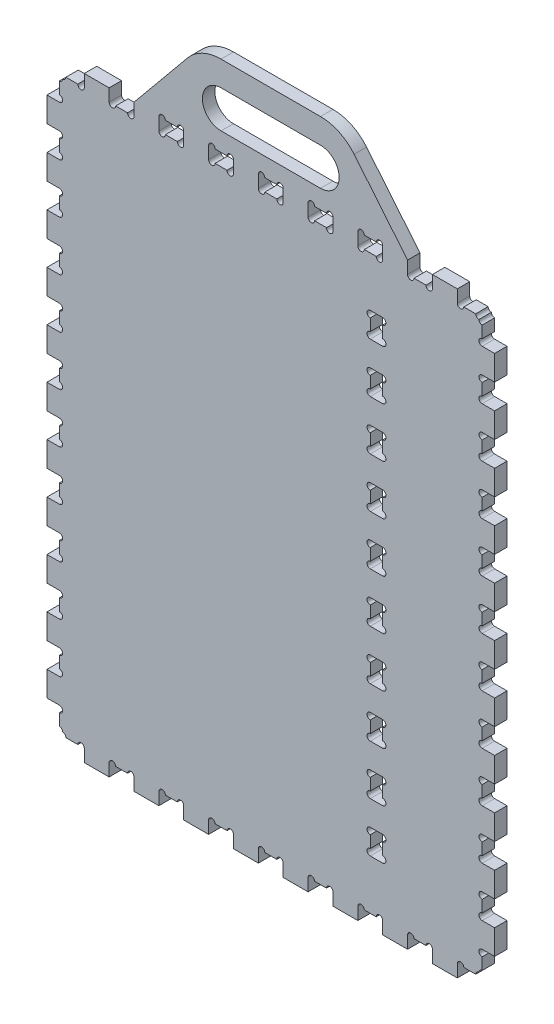
from build123d import *

# Parameters (mm, degrees)
SKETCH1_W               = 457.2
SKETCH1_H               = 609.6
BOSS_EXTRUDE1_DEPTH     = 12.7
CUT_EXTRUDE1_DEPTH      = 382.211607903
LPATTERN1_COUNT         = 9
LPATTERN1_PITCH         = 50.8
SKETCH6_W               = 12.7
SKETCH6_H               = 12.7
CUT_EXTRUDE4_DEPTH      = 382.211607903
CUT_EXTRUDE2_DEPTH      = 382.211607903
LPATTERN2_COUNT         = 12
LPATTERN2_PITCH         = 50.8
MIRROR7_COPY_1_SKETCH_W = 12.7
MIRROR7_COPY_1_SKETCH_H = 12.7
MIRROR7_COPY_1_DEPTH    = 382.211607903
MIRROR1_COPY_1_DEPTH    = 382.211607903
MIRROR1_COPY_2_DEPTH    = 382.211607903
MIRROR1_COPY_3_DEPTH    = 382.211607903
MIRROR1_COPY_4_DEPTH    = 382.211607903
MIRROR1_COPY_5_DEPTH    = 382.211607903
MIRROR1_COPY_6_DEPTH    = 382.211607903
MIRROR1_COPY_7_DEPTH    = 382.211607903
MIRROR1_COPY_8_DEPTH    = 382.211607903
MIRROR1_COPY_9_DEPTH    = 382.211607903
MIRROR1_COPY_10_DEPTH   = 382.211607903
MIRROR1_COPY_11_DEPTH   = 382.211607903
MIRROR1_COPY_12_DEPTH   = 382.211607903
MIRROR2_COPY_1_DEPTH    = 382.211607903
MIRROR2_COPY_2_DEPTH    = 382.211607903
MIRROR2_COPY_3_DEPTH    = 382.211607903
MIRROR2_COPY_4_DEPTH    = 382.211607903
MIRROR2_COPY_5_DEPTH    = 382.211607903
MIRROR2_COPY_6_DEPTH    = 382.211607903
MIRROR2_COPY_7_DEPTH    = 382.211607903
MIRROR2_COPY_8_DEPTH    = 382.211607903
MIRROR2_COPY_9_DEPTH    = 382.211607903
BOSS_EXTRUDE3_DEPTH     = 12.7
SKETCH10_R              = 3.302
CUT_EXTRUDE6_DEPTH      = 12.7
LPATTERN3_COUNT         = 5
LPATTERN3_PITCH         = 50.8
CUT_EXTRUDE7_DEPTH      = 450.954744947
LPATTERN4_COUNT         = 10
LPATTERN4_PITCH         = 50.8


with BuildPart() as part:
    # Sketch1 → Boss-Extrude1 (new body)
    with BuildSketch(Plane.XY):
        Rectangle(SKETCH1_W, SKETCH1_H)
    extrude(amount=BOSS_EXTRUDE1_DEPTH)

    # Sketch2 → Cut-Extrude1 (cut, through all)
    with BuildSketch(Plane.XY.offset(12.7)):
        with BuildLine():
            Line((-190.5, 304.8), (-215.9, 304.8))
            Line((-215.9, 304.8), (-215.9, 292.1))
            ThreePointArc((-215.9, 292.1), (-212.598, 288.798), (-209.296, 292.1))
            Line((-209.296, 292.1), (-197.104, 292.1))
            ThreePointArc((-197.104, 292.1), (-193.802, 288.798), (-190.5, 292.1))
            Line((-190.5, 292.1), (-190.5, 304.8))
        make_face()
    cut_extrude1 = extrude(amount=-CUT_EXTRUDE1_DEPTH, mode=Mode.SUBTRACT)

    # LPattern1: Cut-Extrude1 ×9
    with Locations(*[(i * LPATTERN1_PITCH, 0, 0) for i in range(1, LPATTERN1_COUNT)]):
        add(cut_extrude1, mode=Mode.SUBTRACT)

    # Sketch6 → Cut-Extrude4 (cut, through all)
    with BuildSketch(Plane.XY.offset(12.7)):
        with Locations((-222.25, 298.45)):
            Rectangle(SKETCH6_W, SKETCH6_H)
    cut_extrude4 = extrude(amount=-CUT_EXTRUDE4_DEPTH, mode=Mode.SUBTRACT)

    # Sketch3 → Cut-Extrude2 (cut, through all)
    with BuildSketch(Plane.XY.offset(12.7)):
        with BuildLine():
            Line((-215.9, 292.1), (-228.6, 292.1))
            Line((-228.6, 292.1), (-228.6, 266.7))
            Line((-228.6, 266.7), (-215.9, 266.7))
            ThreePointArc((-215.9, 266.7), (-212.598, 270.002), (-215.9, 273.304))
            Line((-215.9, 273.304), (-215.9, 285.496))
            ThreePointArc((-215.9, 285.496), (-212.598, 288.798), (-215.9, 292.1))
        make_face()
    cut_extrude2 = extrude(amount=-CUT_EXTRUDE2_DEPTH, mode=Mode.SUBTRACT)

    # LPattern2: Cut-Extrude2 ×12
    with Locations(*[(0, -i * LPATTERN2_PITCH, 0) for i in range(1, LPATTERN2_COUNT)]):
        add(cut_extrude2, mode=Mode.SUBTRACT)

    # Mirror6: Cut-Extrude4 across plane
    add(cut_extrude4.mirror(Plane(origin=(0, 0, 0), x_dir=(0, 0, 1), z_dir=(1, 0, 0))), mode=Mode.SUBTRACT)

    # Mirror7: Cut-Extrude4 across plane
    add(cut_extrude4.mirror(Plane.ZX), mode=Mode.SUBTRACT)

    # Mirror7 copy 1 sketch → Mirror7 copy 1 (cut, through all)
    with BuildSketch(Plane(origin=(0, 0, 12.7), x_dir=(-1, 0, 0), z_dir=(0, 0, 1))):
        with Locations((-222.25, 298.45)):
            Rectangle(MIRROR7_COPY_1_SKETCH_W, MIRROR7_COPY_1_SKETCH_H)
    extrude(amount=-MIRROR7_COPY_1_DEPTH, mode=Mode.SUBTRACT)

    # Mirror1 copy 1 sketch → Mirror1 copy 1 (cut, through all)
    with BuildSketch(Plane(origin=(0, -50.8, 12.7), x_dir=(-1, 0, 0), z_dir=(0, 0, 1))):
        with BuildLine():
            Line((-215.9, -292.1), (-228.6, -292.1))
            Line((-228.6, -292.1), (-228.6, -266.7))
            Line((-228.6, -266.7), (-215.9, -266.7))
            ThreePointArc((-215.9, -266.7), (-212.598, -270.002), (-215.9, -273.304))
            Line((-215.9, -273.304), (-215.9, -285.496))
            ThreePointArc((-215.9, -285.496), (-212.598, -288.798), (-215.9, -292.1))
        make_face()
    extrude(amount=-MIRROR1_COPY_1_DEPTH, mode=Mode.SUBTRACT)

    # Mirror1 copy 2 sketch → Mirror1 copy 2 (cut, through all)
    with BuildSketch(Plane(origin=(0, -101.6, 12.7), x_dir=(-1, 0, 0), z_dir=(0, 0, 1))):
        with BuildLine():
            Line((-215.9, -292.1), (-228.6, -292.1))
            Line((-228.6, -292.1), (-228.6, -266.7))
            Line((-228.6, -266.7), (-215.9, -266.7))
            ThreePointArc((-215.9, -266.7), (-212.598, -270.002), (-215.9, -273.304))
            Line((-215.9, -273.304), (-215.9, -285.496))
            ThreePointArc((-215.9, -285.496), (-212.598, -288.798), (-215.9, -292.1))
        make_face()
    extrude(amount=-MIRROR1_COPY_2_DEPTH, mode=Mode.SUBTRACT)

    # Mirror1 copy 3 sketch → Mirror1 copy 3 (cut, through all)
    with BuildSketch(Plane(origin=(0, -152.4, 12.7), x_dir=(-1, 0, 0), z_dir=(0, 0, 1))):
        with BuildLine():
            Line((-215.9, -292.1), (-228.6, -292.1))
            Line((-228.6, -292.1), (-228.6, -266.7))
            Line((-228.6, -266.7), (-215.9, -266.7))
            ThreePointArc((-215.9, -266.7), (-212.598, -270.002), (-215.9, -273.304))
            Line((-215.9, -273.304), (-215.9, -285.496))
            ThreePointArc((-215.9, -285.496), (-212.598, -288.798), (-215.9, -292.1))
        make_face()
    extrude(amount=-MIRROR1_COPY_3_DEPTH, mode=Mode.SUBTRACT)

    # Mirror1 copy 4 sketch → Mirror1 copy 4 (cut, through all)
    with BuildSketch(Plane(origin=(0, -203.2, 12.7), x_dir=(-1, 0, 0), z_dir=(0, 0, 1))):
        with BuildLine():
            Line((-215.9, -292.1), (-228.6, -292.1))
            Line((-228.6, -292.1), (-228.6, -266.7))
            Line((-228.6, -266.7), (-215.9, -266.7))
            ThreePointArc((-215.9, -266.7), (-212.598, -270.002), (-215.9, -273.304))
            Line((-215.9, -273.304), (-215.9, -285.496))
            ThreePointArc((-215.9, -285.496), (-212.598, -288.798), (-215.9, -292.1))
        make_face()
    extrude(amount=-MIRROR1_COPY_4_DEPTH, mode=Mode.SUBTRACT)

    # Mirror1 copy 5 sketch → Mirror1 copy 5 (cut, through all)
    with BuildSketch(Plane(origin=(0, -254, 12.7), x_dir=(-1, 0, 0), z_dir=(0, 0, 1))):
        with BuildLine():
            Line((-215.9, -292.1), (-228.6, -292.1))
            Line((-228.6, -292.1), (-228.6, -266.7))
            Line((-228.6, -266.7), (-215.9, -266.7))
            ThreePointArc((-215.9, -266.7), (-212.598, -270.002), (-215.9, -273.304))
            Line((-215.9, -273.304), (-215.9, -285.496))
            ThreePointArc((-215.9, -285.496), (-212.598, -288.798), (-215.9, -292.1))
        make_face()
    extrude(amount=-MIRROR1_COPY_5_DEPTH, mode=Mode.SUBTRACT)

    # Mirror1 copy 6 sketch → Mirror1 copy 6 (cut, through all)
    with BuildSketch(Plane(origin=(0, -304.8, 12.7), x_dir=(-1, 0, 0), z_dir=(0, 0, 1))):
        with BuildLine():
            Line((-215.9, -292.1), (-228.6, -292.1))
            Line((-228.6, -292.1), (-228.6, -266.7))
            Line((-228.6, -266.7), (-215.9, -266.7))
            ThreePointArc((-215.9, -266.7), (-212.598, -270.002), (-215.9, -273.304))
            Line((-215.9, -273.304), (-215.9, -285.496))
            ThreePointArc((-215.9, -285.496), (-212.598, -288.798), (-215.9, -292.1))
        make_face()
    extrude(amount=-MIRROR1_COPY_6_DEPTH, mode=Mode.SUBTRACT)

    # Mirror1 copy 7 sketch → Mirror1 copy 7 (cut, through all)
    with BuildSketch(Plane(origin=(0, -355.6, 12.7), x_dir=(-1, 0, 0), z_dir=(0, 0, 1))):
        with BuildLine():
            Line((-215.9, -292.1), (-228.6, -292.1))
            Line((-228.6, -292.1), (-228.6, -266.7))
            Line((-228.6, -266.7), (-215.9, -266.7))
            ThreePointArc((-215.9, -266.7), (-212.598, -270.002), (-215.9, -273.304))
            Line((-215.9, -273.304), (-215.9, -285.496))
            ThreePointArc((-215.9, -285.496), (-212.598, -288.798), (-215.9, -292.1))
        make_face()
    extrude(amount=-MIRROR1_COPY_7_DEPTH, mode=Mode.SUBTRACT)

    # Mirror1 copy 8 sketch → Mirror1 copy 8 (cut, through all)
    with BuildSketch(Plane(origin=(0, -406.4, 12.7), x_dir=(-1, 0, 0), z_dir=(0, 0, 1))):
        with BuildLine():
            Line((-215.9, -292.1), (-228.6, -292.1))
            Line((-228.6, -292.1), (-228.6, -266.7))
            Line((-228.6, -266.7), (-215.9, -266.7))
            ThreePointArc((-215.9, -266.7), (-212.598, -270.002), (-215.9, -273.304))
            Line((-215.9, -273.304), (-215.9, -285.496))
            ThreePointArc((-215.9, -285.496), (-212.598, -288.798), (-215.9, -292.1))
        make_face()
    extrude(amount=-MIRROR1_COPY_8_DEPTH, mode=Mode.SUBTRACT)

    # Mirror1 copy 9 sketch → Mirror1 copy 9 (cut, through all)
    with BuildSketch(Plane(origin=(0, -457.2, 12.7), x_dir=(-1, 0, 0), z_dir=(0, 0, 1))):
        with BuildLine():
            Line((-215.9, -292.1), (-228.6, -292.1))
            Line((-228.6, -292.1), (-228.6, -266.7))
            Line((-228.6, -266.7), (-215.9, -266.7))
            ThreePointArc((-215.9, -266.7), (-212.598, -270.002), (-215.9, -273.304))
            Line((-215.9, -273.304), (-215.9, -285.496))
            ThreePointArc((-215.9, -285.496), (-212.598, -288.798), (-215.9, -292.1))
        make_face()
    extrude(amount=-MIRROR1_COPY_9_DEPTH, mode=Mode.SUBTRACT)

    # Mirror1 copy 10 sketch → Mirror1 copy 10 (cut, through all)
    with BuildSketch(Plane(origin=(0, -508, 12.7), x_dir=(-1, 0, 0), z_dir=(0, 0, 1))):
        with BuildLine():
            Line((-215.9, -292.1), (-228.6, -292.1))
            Line((-228.6, -292.1), (-228.6, -266.7))
            Line((-228.6, -266.7), (-215.9, -266.7))
            ThreePointArc((-215.9, -266.7), (-212.598, -270.002), (-215.9, -273.304))
            Line((-215.9, -273.304), (-215.9, -285.496))
            ThreePointArc((-215.9, -285.496), (-212.598, -288.798), (-215.9, -292.1))
        make_face()
    extrude(amount=-MIRROR1_COPY_10_DEPTH, mode=Mode.SUBTRACT)

    # Mirror1 copy 11 sketch → Mirror1 copy 11 (cut, through all)
    with BuildSketch(Plane(origin=(0, -558.8, 12.7), x_dir=(-1, 0, 0), z_dir=(0, 0, 1))):
        with BuildLine():
            Line((-215.9, -292.1), (-228.6, -292.1))
            Line((-228.6, -292.1), (-228.6, -266.7))
            Line((-228.6, -266.7), (-215.9, -266.7))
            ThreePointArc((-215.9, -266.7), (-212.598, -270.002), (-215.9, -273.304))
            Line((-215.9, -273.304), (-215.9, -285.496))
            ThreePointArc((-215.9, -285.496), (-212.598, -288.798), (-215.9, -292.1))
        make_face()
    extrude(amount=-MIRROR1_COPY_11_DEPTH, mode=Mode.SUBTRACT)

    # Mirror1 copy 12 sketch → Mirror1 copy 12 (cut, through all)
    with BuildSketch(Plane(origin=(0, 0, 12.7), x_dir=(-1, 0, 0), z_dir=(0, 0, 1))):
        with BuildLine():
            Line((-215.9, -292.1), (-228.6, -292.1))
            Line((-228.6, -292.1), (-228.6, -266.7))
            Line((-228.6, -266.7), (-215.9, -266.7))
            ThreePointArc((-215.9, -266.7), (-212.598, -270.002), (-215.9, -273.304))
            Line((-215.9, -273.304), (-215.9, -285.496))
            ThreePointArc((-215.9, -285.496), (-212.598, -288.798), (-215.9, -292.1))
        make_face()
    extrude(amount=-MIRROR1_COPY_12_DEPTH, mode=Mode.SUBTRACT)

    # Mirror2 copy 1 sketch → Mirror2 copy 1 (cut, through all)
    with BuildSketch(Plane(origin=(50.8, 0, 12.7), x_dir=(1, 0, 0), z_dir=(0, 0, 1))):
        with BuildLine():
            Line((-190.5, -304.8), (-215.9, -304.8))
            Line((-215.9, -304.8), (-215.9, -292.1))
            ThreePointArc((-215.9, -292.1), (-212.598, -288.798), (-209.296, -292.1))
            Line((-209.296, -292.1), (-197.104, -292.1))
            ThreePointArc((-197.104, -292.1), (-193.802, -288.798), (-190.5, -292.1))
            Line((-190.5, -292.1), (-190.5, -304.8))
        make_face()
    extrude(amount=-MIRROR2_COPY_1_DEPTH, mode=Mode.SUBTRACT)

    # Mirror2 copy 2 sketch → Mirror2 copy 2 (cut, through all)
    with BuildSketch(Plane(origin=(101.6, 0, 12.7), x_dir=(1, 0, 0), z_dir=(0, 0, 1))):
        with BuildLine():
            Line((-190.5, -304.8), (-215.9, -304.8))
            Line((-215.9, -304.8), (-215.9, -292.1))
            ThreePointArc((-215.9, -292.1), (-212.598, -288.798), (-209.296, -292.1))
            Line((-209.296, -292.1), (-197.104, -292.1))
            ThreePointArc((-197.104, -292.1), (-193.802, -288.798), (-190.5, -292.1))
            Line((-190.5, -292.1), (-190.5, -304.8))
        make_face()
    extrude(amount=-MIRROR2_COPY_2_DEPTH, mode=Mode.SUBTRACT)

    # Mirror2 copy 3 sketch → Mirror2 copy 3 (cut, through all)
    with BuildSketch(Plane(origin=(152.4, 0, 12.7), x_dir=(1, 0, 0), z_dir=(0, 0, 1))):
        with BuildLine():
            Line((-190.5, -304.8), (-215.9, -304.8))
            Line((-215.9, -304.8), (-215.9, -292.1))
            ThreePointArc((-215.9, -292.1), (-212.598, -288.798), (-209.296, -292.1))
            Line((-209.296, -292.1), (-197.104, -292.1))
            ThreePointArc((-197.104, -292.1), (-193.802, -288.798), (-190.5, -292.1))
            Line((-190.5, -292.1), (-190.5, -304.8))
        make_face()
    extrude(amount=-MIRROR2_COPY_3_DEPTH, mode=Mode.SUBTRACT)

    # Mirror2 copy 4 sketch → Mirror2 copy 4 (cut, through all)
    with BuildSketch(Plane(origin=(203.2, 0, 12.7), x_dir=(1, 0, 0), z_dir=(0, 0, 1))):
        with BuildLine():
            Line((-190.5, -304.8), (-215.9, -304.8))
            Line((-215.9, -304.8), (-215.9, -292.1))
            ThreePointArc((-215.9, -292.1), (-212.598, -288.798), (-209.296, -292.1))
            Line((-209.296, -292.1), (-197.104, -292.1))
            ThreePointArc((-197.104, -292.1), (-193.802, -288.798), (-190.5, -292.1))
            Line((-190.5, -292.1), (-190.5, -304.8))
        make_face()
    extrude(amount=-MIRROR2_COPY_4_DEPTH, mode=Mode.SUBTRACT)

    # Mirror2 copy 5 sketch → Mirror2 copy 5 (cut, through all)
    with BuildSketch(Plane(origin=(254, 0, 12.7), x_dir=(1, 0, 0), z_dir=(0, 0, 1))):
        with BuildLine():
            Line((-190.5, -304.8), (-215.9, -304.8))
            Line((-215.9, -304.8), (-215.9, -292.1))
            ThreePointArc((-215.9, -292.1), (-212.598, -288.798), (-209.296, -292.1))
            Line((-209.296, -292.1), (-197.104, -292.1))
            ThreePointArc((-197.104, -292.1), (-193.802, -288.798), (-190.5, -292.1))
            Line((-190.5, -292.1), (-190.5, -304.8))
        make_face()
    extrude(amount=-MIRROR2_COPY_5_DEPTH, mode=Mode.SUBTRACT)

    # Mirror2 copy 6 sketch → Mirror2 copy 6 (cut, through all)
    with BuildSketch(Plane(origin=(304.8, 0, 12.7), x_dir=(1, 0, 0), z_dir=(0, 0, 1))):
        with BuildLine():
            Line((-190.5, -304.8), (-215.9, -304.8))
            Line((-215.9, -304.8), (-215.9, -292.1))
            ThreePointArc((-215.9, -292.1), (-212.598, -288.798), (-209.296, -292.1))
            Line((-209.296, -292.1), (-197.104, -292.1))
            ThreePointArc((-197.104, -292.1), (-193.802, -288.798), (-190.5, -292.1))
            Line((-190.5, -292.1), (-190.5, -304.8))
        make_face()
    extrude(amount=-MIRROR2_COPY_6_DEPTH, mode=Mode.SUBTRACT)

    # Mirror2 copy 7 sketch → Mirror2 copy 7 (cut, through all)
    with BuildSketch(Plane(origin=(355.6, 0, 12.7), x_dir=(1, 0, 0), z_dir=(0, 0, 1))):
        with BuildLine():
            Line((-190.5, -304.8), (-215.9, -304.8))
            Line((-215.9, -304.8), (-215.9, -292.1))
            ThreePointArc((-215.9, -292.1), (-212.598, -288.798), (-209.296, -292.1))
            Line((-209.296, -292.1), (-197.104, -292.1))
            ThreePointArc((-197.104, -292.1), (-193.802, -288.798), (-190.5, -292.1))
            Line((-190.5, -292.1), (-190.5, -304.8))
        make_face()
    extrude(amount=-MIRROR2_COPY_7_DEPTH, mode=Mode.SUBTRACT)

    # Mirror2 copy 8 sketch → Mirror2 copy 8 (cut, through all)
    with BuildSketch(Plane(origin=(406.4, 0, 12.7), x_dir=(1, 0, 0), z_dir=(0, 0, 1))):
        with BuildLine():
            Line((-190.5, -304.8), (-215.9, -304.8))
            Line((-215.9, -304.8), (-215.9, -292.1))
            ThreePointArc((-215.9, -292.1), (-212.598, -288.798), (-209.296, -292.1))
            Line((-209.296, -292.1), (-197.104, -292.1))
            ThreePointArc((-197.104, -292.1), (-193.802, -288.798), (-190.5, -292.1))
            Line((-190.5, -292.1), (-190.5, -304.8))
        make_face()
    extrude(amount=-MIRROR2_COPY_8_DEPTH, mode=Mode.SUBTRACT)

    # Mirror2 copy 9 sketch → Mirror2 copy 9 (cut, through all)
    with BuildSketch(Plane.XY.offset(12.7)):
        with BuildLine():
            Line((-190.5, -304.8), (-215.9, -304.8))
            Line((-215.9, -304.8), (-215.9, -292.1))
            ThreePointArc((-215.9, -292.1), (-212.598, -288.798), (-209.296, -292.1))
            Line((-209.296, -292.1), (-197.104, -292.1))
            ThreePointArc((-197.104, -292.1), (-193.802, -288.798), (-190.5, -292.1))
            Line((-190.5, -292.1), (-190.5, -304.8))
        make_face()
    extrude(amount=-MIRROR2_COPY_9_DEPTH, mode=Mode.SUBTRACT)

    # Sketch9 → Boss-Extrude3 (add)
    with BuildSketch(Plane(origin=(0, 0, 0), x_dir=(-1, 0, 0), z_dir=(0, 0, -1))):
        with BuildLine():
            Line((-85.127373824, 371.138872257), (-139.7, 304.8))
            Line((-139.7, 304.8), (27.904749401, 304.8))
            Line((27.904749401, 304.8), (139.7, 304.8))
            Line((139.7, 304.8), (85.127373824, 371.138872257))
            ThreePointArc((85.127373824, 371.138872257), (69.781367551, 383.093409732), (50.8, 387.35))
            Line((50.8, 387.35), (-50.8, 387.35))
            ThreePointArc((-50.8, 387.35), (-69.781367551, 383.093409732), (-85.127373824, 371.138872257))
        make_face()
        with BuildLine():
            ThreePointArc((-50.8, 323.85), (-69.85, 342.9), (-50.8, 361.95))
            Line((-50.8, 361.95), (50.8, 361.95))
            ThreePointArc((50.8, 361.95), (69.85, 342.9), (50.8, 323.85))
            Line((50.8, 323.85), (-50.8, 323.85))
        make_face(mode=Mode.SUBTRACT)
    extrude(amount=-BOSS_EXTRUDE3_DEPTH)

    # Sketch10 → Cut-Extrude6 (cut)
    with BuildSketch(Plane(origin=(0, 0, 0), x_dir=(-1, 0, 0), z_dir=(0, 0, -1))):
        with Locations((-110.998, 304.8)):
            Circle(SKETCH10_R)
        with Locations((-92.202, 304.8)):
            Circle(SKETCH10_R)
    cut_extrude6 = extrude(amount=-CUT_EXTRUDE6_DEPTH, mode=Mode.SUBTRACT)

    # LPattern3: Cut-Extrude6 ×5
    with Locations(*[(-i * LPATTERN3_PITCH, 0, 0) for i in range(1, LPATTERN3_COUNT)]):
        add(cut_extrude6, mode=Mode.SUBTRACT)

    # Sketch11 → Cut-Extrude7 (cut, through all)
    with BuildSketch(Plane(origin=(0, 0, 0), x_dir=(-1, 0, 0), z_dir=(0, 0, -1))):
        with BuildLine():
            Line((-101.6, 241.3), (-114.3, 241.3))
            ThreePointArc((-114.3, 241.3), (-117.602, 237.998), (-114.3, 234.696))
            Line((-114.3, 234.696), (-114.3, 222.504))
            ThreePointArc((-114.3, 222.504), (-117.602, 219.202), (-114.3, 215.9))
            Line((-114.3, 215.9), (-101.6, 215.9))
            ThreePointArc((-101.6, 215.9), (-98.298, 219.202), (-101.6, 222.504))
            Line((-101.6, 222.504), (-101.6, 234.696))
            ThreePointArc((-101.6, 234.696), (-98.298, 237.998), (-101.6, 241.3))
        make_face()
    cut_extrude7 = extrude(amount=-CUT_EXTRUDE7_DEPTH, mode=Mode.SUBTRACT)

    # LPattern4: Cut-Extrude7 ×10
    with Locations(*[(0, -i * LPATTERN4_PITCH, 0) for i in range(1, LPATTERN4_COUNT)]):
        add(cut_extrude7, mode=Mode.SUBTRACT)


solid = part.part
